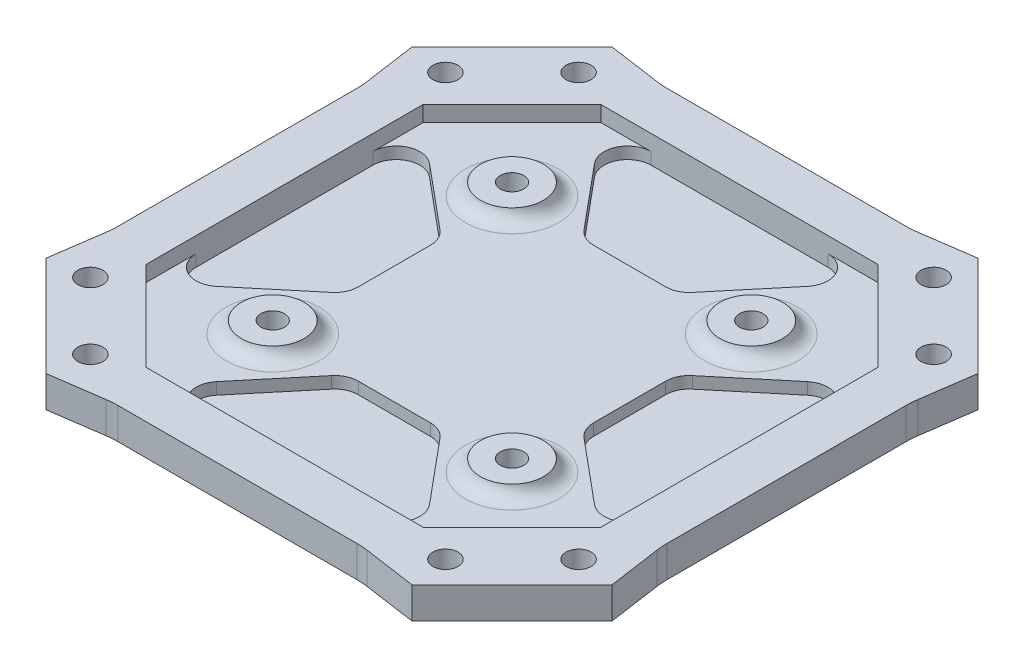
from build123d import *

# Parameters (mm, degrees)
SKETCH1_R           = 1.6
BOSS_EXTRUDE1_DEPTH = 4
CUT_EXTRUDE1_DEPTH  = 2
CUT_EXTRUDE2_DEPTH  = 1.5
SKETCH4_R           = 1.5
CUT_EXTRUDE3_DEPTH  = 52.039200621
BOSS_EXTRUDE4_START = 1.5
SKETCH5_R           = 4
SKETCH5_R_2         = 1.5
BOSS_EXTRUDE4_DEPTH = 1.5
CIRPATTERN1_COUNT   = 4
FILLET1_R           = 2
FILLET2_R           = 10


with BuildPart() as part:
    # Sketch1 → Boss-Extrude1 (new body)
    with BuildSketch(Plane(origin=(0, 0, 0), x_dir=(1, 0, 0), z_dir=(0, 1, 0))):
        Polygon((15.934040652, 35), (-15.934040652, 35), (-23.334523779, 36.062445841), (-36.062445841, 23.334523779), (-35, 15.934040652), (-35, -15.934040652), (-36.062445841, -23.334523779), (-23.334523779, -36.062445841), (-15.934040652, -35), (15.934040652, -35), (23.334523779, -36.062445841), (36.062445841, -23.334523779), (35, -15.934040652), (35, 15.934040652), (36.062445841, 23.334523779), (23.334523779, 36.062445841), align=None)
        with Locations(Location((22.627416998, 31.112698372, 0), (0, 0, 270))):
            Circle(SKETCH1_R, mode=Mode.SUBTRACT)
        with Locations(Location((31.112698372, 22.627416998, 0), (0, 0, 270))):
            Circle(SKETCH1_R, mode=Mode.SUBTRACT)
        with Locations(Location((22.627416998, -31.112698372, 0), (0, 0, 270))):
            Circle(SKETCH1_R, mode=Mode.SUBTRACT)
        with Locations(Location((31.112698372, -22.627416998, 0), (0, 0, 270))):
            Circle(SKETCH1_R, mode=Mode.SUBTRACT)
        with Locations(Location((-31.112698372, -22.627416998, 0), (0, 0, 270))):
            Circle(SKETCH1_R, mode=Mode.SUBTRACT)
        with Locations(Location((-22.627416998, -31.112698372, 0), (0, 0, 270))):
            Circle(SKETCH1_R, mode=Mode.SUBTRACT)
        with Locations(Location((-22.627416998, 31.112698372, 0), (0, 0, 270))):
            Circle(SKETCH1_R, mode=Mode.SUBTRACT)
        with Locations(Location((-31.112698372, 22.627416998, 0), (0, 0, 270))):
            Circle(SKETCH1_R, mode=Mode.SUBTRACT)
    extrude(amount=BOSS_EXTRUDE1_DEPTH)

    # Sketch2 → Cut-Extrude1 (cut)
    with BuildSketch(Plane(origin=(0, 4, 0), x_dir=(1, 0, 0), z_dir=(0, 1, 0))):
        Polygon((-17.669047558, 29), (17.669047558, 29), (29, 17.669047558), (29, -17.669047558), (17.669047558, -29), (-17.669047558, -29), (-29, -17.669047558), (-29, 17.669047558), align=None)
    extrude(amount=-CUT_EXTRUDE1_DEPTH, mode=Mode.SUBTRACT)

    # Sketch3 → Cut-Extrude2 (cut)
    with BuildSketch(Plane(origin=(0, 2, 0), x_dir=(1, 0, 0), z_dir=(0, 1, 0))):
        with BuildLine():
            Line((-15, -4.595058717), (-15, 4.595058717))
            ThreePointArc((-15, 4.595058717), (-15.283167889, 5.867388581), (-16.079215521, 6.899529803))
            Line((-16.079215521, 6.899529803), (-24.079215521, 13.567556979))
            ThreePointArc((-24.079215521, 13.567556979), (-27.272329864, 13.979918004), (-29, 11.263085893))
            Line((-29, 11.263085893), (-29, -11.263085893))
            ThreePointArc((-29, -11.263085893), (-27.272329864, -13.979918004), (-24.079215521, -13.567556979))
            Line((-24.079215521, -13.567556979), (-16.079215521, -6.899529803))
            ThreePointArc((-16.079215521, -6.899529803), (-15.283167889, -5.867388581), (-15, -4.595058717))
        make_face()
        with BuildLine():
            Line((-13.567556979, 24.079215521), (-6.899529803, 16.079215521))
            ThreePointArc((-6.899529803, 16.079215521), (-5.867388581, 15.283167889), (-4.595058717, 15))
            Line((-4.595058717, 15), (4.595058717, 15))
            ThreePointArc((4.595058717, 15), (5.867388581, 15.283167889), (6.899529803, 16.079215521))
            Line((6.899529803, 16.079215521), (13.567556979, 24.079215521))
            ThreePointArc((13.567556979, 24.079215521), (13.979918004, 27.272329864), (11.263085893, 29))
            Line((11.263085893, 29), (-11.263085893, 29))
            ThreePointArc((-11.263085893, 29), (-13.979918004, 27.272329864), (-13.567556979, 24.079215521))
        make_face()
        with BuildLine():
            Line((24.079215521, 13.567556979), (16.079215521, 6.899529803))
            ThreePointArc((16.079215521, 6.899529803), (15.283167889, 5.867388581), (15, 4.595058717))
            Line((15, 4.595058717), (15, -4.595058717))
            ThreePointArc((15, -4.595058717), (15.283167889, -5.867388581), (16.079215521, -6.899529803))
            Line((16.079215521, -6.899529803), (24.079215521, -13.567556979))
            ThreePointArc((24.079215521, -13.567556979), (27.272329864, -13.979918004), (29, -11.263085893))
            Line((29, -11.263085893), (29, 11.263085893))
            ThreePointArc((29, 11.263085893), (27.272329864, 13.979918004), (24.079215521, 13.567556979))
        make_face()
        with BuildLine():
            Line((13.567556979, -24.079215521), (6.899529803, -16.079215521))
            ThreePointArc((6.899529803, -16.079215521), (5.867388581, -15.283167889), (4.595058717, -15))
            Line((4.595058717, -15), (-4.595058717, -15))
            ThreePointArc((-4.595058717, -15), (-5.867388581, -15.283167889), (-6.899529803, -16.079215521))
            Line((-6.899529803, -16.079215521), (-13.567556979, -24.079215521))
            ThreePointArc((-13.567556979, -24.079215521), (-13.979918004, -27.272329864), (-11.263085893, -29))
            Line((-11.263085893, -29), (11.263085893, -29))
            ThreePointArc((11.263085893, -29), (13.979918004, -27.272329864), (13.567556979, -24.079215521))
        make_face()
    extrude(amount=-CUT_EXTRUDE2_DEPTH, mode=Mode.SUBTRACT)

    # Sketch4 → Cut-Extrude3 (cut, through all)
    with BuildSketch(Plane(origin=(0, 2, 0), x_dir=(1, 0, 0), z_dir=(0, 1, 0))):
        with Locations(Location((15.25, 15.25, 0), (0, 0, 270))):
            Circle(SKETCH4_R)
    cut_extrude3 = extrude(amount=-CUT_EXTRUDE3_DEPTH, mode=Mode.SUBTRACT)

    # Sketch5 → Boss-Extrude4 (add)
    with BuildSketch(Plane(origin=(0, 2, 0), x_dir=(1, 0, 0), z_dir=(0, 1, 0)).offset(BOSS_EXTRUDE4_START)):
        with Locations(Location((15.25, 15.25, 0), (0, 0, 90))):
            Circle(SKETCH5_R)
        with Locations(Location((15.25, 15.25, 0), (0, 0, 270))):
            Circle(SKETCH5_R_2, mode=Mode.SUBTRACT)
    boss_extrude4 = extrude(amount=-BOSS_EXTRUDE4_DEPTH)

    # CirPattern1: Cut-Extrude3, Boss-Extrude4 ×4 about axis
    cirpattern1_axis = Axis((0, 0, 0), (0, 1, 0))
    add([cut_extrude3.rotate(cirpattern1_axis, i * 360 / CIRPATTERN1_COUNT) for i in range(1, CIRPATTERN1_COUNT)], mode=Mode.SUBTRACT)
    add([boss_extrude4.rotate(cirpattern1_axis, i * 360 / CIRPATTERN1_COUNT) for i in range(1, CIRPATTERN1_COUNT)])

    # Fillet1
    # the kernel refuses this fillet: 2 mm, written as the material it adds along each edge
    with BuildSketch(Plane(origin=(15.25, 2, -15.25), x_dir=(0, 0, -1), z_dir=(1, 0, 0))) as fillet1_piece_1:
        with BuildLine():
            CenterArc((5.936491673, 2), FILLET1_R, 194.477512186, 75.522487814)
            Line((4, 1.5), (3.961270167, 1.49))
            ThreePointArc((3.961270167, 1.49), (3.96, 0.75), (3.96, 0))
            Line((3.96, 0), (4, -0.04))
            Line((4, -0.04), (5.936491673, -0.04))
            Line((5.936491673, -0.04), (5.936491673, 0))
        make_face()
    revolve(axis=Axis((15.25, 2, -15.25), (0, 1, 0)))
    with BuildSketch(Plane(origin=(15.25, 2, 15.25), x_dir=(1, 0, 0), z_dir=(0, 0, 1))) as fillet1_piece_2:
        with BuildLine():
            CenterArc((5.936491673, 2), FILLET1_R, 194.477512186, 75.522487814)
            Line((4, 1.5), (3.961270167, 1.49))
            ThreePointArc((3.961270167, 1.49), (3.96, 0.75), (3.96, 0))
            Line((3.96, 0), (4, -0.04))
            Line((4, -0.04), (5.936491673, -0.04))
            Line((5.936491673, -0.04), (5.936491673, 0))
        make_face()
    revolve(axis=Axis((15.25, 2, 15.25), (0, 1, 0)))
    with BuildSketch(Plane(origin=(-15.25, 2, 15.25), x_dir=(0, 0, 1), z_dir=(-1, 0, 0))) as fillet1_piece_3:
        with BuildLine():
            CenterArc((5.936491673, 2), FILLET1_R, 194.477512186, 75.522487814)
            Line((4, 1.5), (3.961270167, 1.49))
            ThreePointArc((3.961270167, 1.49), (3.96, 0.75), (3.96, 0))
            Line((3.96, 0), (4, -0.04))
            Line((4, -0.04), (5.936491673, -0.04))
            Line((5.936491673, -0.04), (5.936491673, 0))
        make_face()
    revolve(axis=Axis((-15.25, 2, 15.25), (0, 1, 0)))
    with BuildSketch(Plane(origin=(-15.25, 2, -15.25), x_dir=(-1, 0, 0), z_dir=(0, 0, -1))) as fillet1_piece_4:
        with BuildLine():
            CenterArc((5.936491673, 2), FILLET1_R, 194.477512186, 75.522487814)
            Line((4, 1.5), (3.961270167, 1.49))
            ThreePointArc((3.961270167, 1.49), (3.96, 0.75), (3.96, 0))
            Line((3.96, 0), (4, -0.04))
            Line((4, -0.04), (5.936491673, -0.04))
            Line((5.936491673, -0.04), (5.936491673, 0))
        make_face()
    revolve(axis=Axis((-15.25, 2, -15.25), (0, 1, 0)))

    # Fillet2
    fillet2_edges = [part.edges().sort_by_distance(p)[0] for p in [
        (-15.934040652, 2, -35),
        (15.934040652, 2, -35),
        (35, 2, -15.934040652),
        (35, 2, 15.934040652),
        (15.934040652, 2, 35),
        (-15.934040652, 2, 35),
        (-35, 2, 15.934040652),
        (-35, 2, -15.934040652),
    ]]
    fillet(fillet2_edges, radius=FILLET2_R)


solid = part.part
